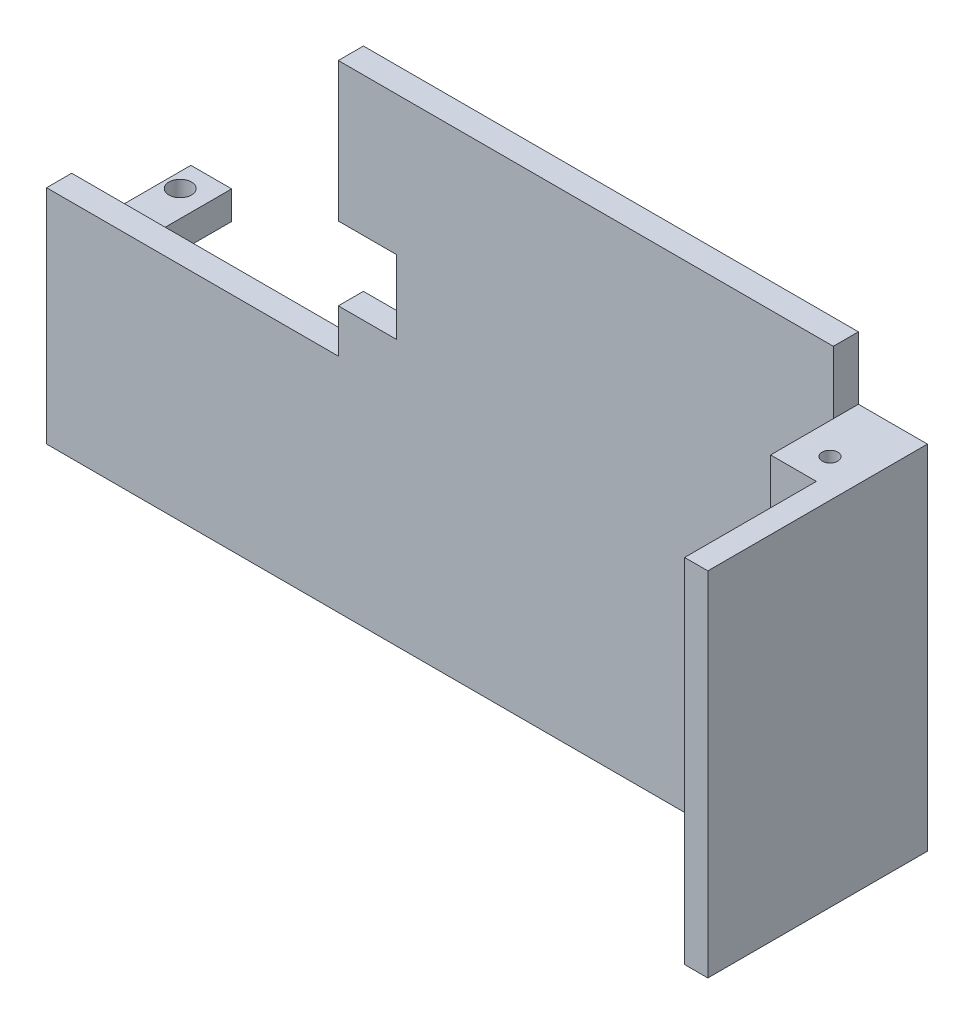
from build123d import *

# Parameters (mm, degrees)
BOSS_EXTRUDE1_DEPTH = 76.2
SKETCH2_W           = 46.5
SKETCH2_H           = 26.89406393
BOSS_EXTRUDE2_DEPTH = 4
SKETCH5_W           = 9.285994966
SKETCH5_H           = 11.707020407
CUT_EXTRUDE2_DEPTH  = 5
SKETCH6_R           = 1.25
CUT_EXTRUDE3_DEPTH  = 85
SKETCH7_W           = 10
SKETCH7_H           = 14
CUT_EXTRUDE4_DEPTH  = 10
SKETCH8_W           = 10
SKETCH8_H           = 14
CUT_EXTRUDE5_DEPTH  = 10
SKETCH9_W           = 3.7
SKETCH9_H           = 35
BOSS_EXTRUDE4_DEPTH = 56.2
SKETCH10_W          = 46.5
SKETCH10_H          = 8.496116432
BOSS_EXTRUDE5_DEPTH = 4
SKETCH11_W          = 6.644809846
SKETCH11_H          = 4.508222244
SKETCH11_W_2        = 6.5
BOSS_EXTRUDE6_DEPTH = 19
SKETCH12_R          = 1.8
CUT_EXTRUDE6_DEPTH  = 19


with BuildPart() as part:
    # Sketch1 → Boss-Extrude1 (new body)
    with BuildSketch(Plane(origin=(0, 0, 0), x_dir=(1, 0, 0), z_dir=(0, 1, 0))):
        Polygon((0, 4), (0, 0), (78.9, 0), (78.9, -10), (88.9, -10), (88.9, 4), align=None)
    extrude(amount=BOSS_EXTRUDE1_DEPTH)

    # Sketch2 → Boss-Extrude2 (add)
    with BuildSketch(Plane(origin=(0, 0, -4), x_dir=(-1, 0, 0), z_dir=(0, 0, -1))):
        with Locations((23.25, 13.447031965)):
            Rectangle(SKETCH2_W, SKETCH2_H)
    extrude(amount=-BOSS_EXTRUDE2_DEPTH)

    # Sketch5 → Cut-Extrude2 (cut)
    with BuildSketch(Plane(origin=(0, 0, -4), x_dir=(-1, 0, 0), z_dir=(0, 0, -1))):
        with Locations((-4.642997483, 48.187124879)):
            Rectangle(SKETCH5_W, SKETCH5_H)
    extrude(amount=-CUT_EXTRUDE2_DEPTH, mode=Mode.SUBTRACT)

    # Sketch6 → Cut-Extrude3 (cut)
    with BuildSketch(Plane(origin=(0, 0, 0), x_dir=(-1, 0, 0), z_dir=(0, -1, 0))):
        with Locations((-83.868179675, -5.5)):
            Circle(SKETCH6_R)
    extrude(amount=-CUT_EXTRUDE3_DEPTH, mode=Mode.SUBTRACT)

    # Sketch7 → Cut-Extrude4 (cut)
    with BuildSketch(Plane.XZ):
        with Locations((83.9, 3)):
            Rectangle(SKETCH7_W, SKETCH7_H)
    extrude(amount=-CUT_EXTRUDE4_DEPTH, mode=Mode.SUBTRACT)

    # Sketch8 → Cut-Extrude5 (cut)
    with BuildSketch(Plane(origin=(0, 76.2, 0), x_dir=(1, 0, 0), z_dir=(0, 1, 0))):
        with Locations((83.9, -3)):
            Rectangle(SKETCH8_W, SKETCH8_H)
    extrude(amount=-CUT_EXTRUDE5_DEPTH, mode=Mode.SUBTRACT)

    # Sketch9 → Boss-Extrude4 (add)
    with BuildSketch(Plane(origin=(0, 66.2, 0), x_dir=(1, 0, 0), z_dir=(0, 1, 0))):
        with Locations((88.05, -13.5)):
            Rectangle(SKETCH9_W, SKETCH9_H)
    extrude(amount=-BOSS_EXTRUDE4_DEPTH)

    # Sketch10 → Boss-Extrude5 (add)
    with BuildSketch(Plane.XY):
        with Locations((-23.25, 31.142122146)):
            Rectangle(SKETCH10_W, SKETCH10_H)
    extrude(amount=-BOSS_EXTRUDE5_DEPTH)

    # Sketch11 → Boss-Extrude6 (add)
    with BuildSketch(Plane(origin=(0, 0, -4), x_dir=(-1, 0, 0), z_dir=(0, 0, -1))):
        with Locations((-3.622404923, 24.725888878)):
            Rectangle(SKETCH11_W, SKETCH11_H)
        with Locations((43.25, 24.725888878)):
            Rectangle(SKETCH11_W_2, SKETCH11_H)
    extrude(amount=BOSS_EXTRUDE6_DEPTH)

    # Sketch12 → Cut-Extrude6 (cut)
    with BuildSketch(Plane(origin=(0, 26.98, 0), x_dir=(1, 0, 0), z_dir=(0, 1, 0))):
        with Locations((-44.15, 18.95)):
            Circle(SKETCH12_R)
        with Locations((-44.15, 9.05)):
            Circle(SKETCH12_R)
        with Locations((3.85, 18.95)):
            Circle(SKETCH12_R)
        with Locations((3.85, 9.05)):
            Circle(SKETCH12_R)
    extrude(amount=-CUT_EXTRUDE6_DEPTH, mode=Mode.SUBTRACT)


solid = part.part
